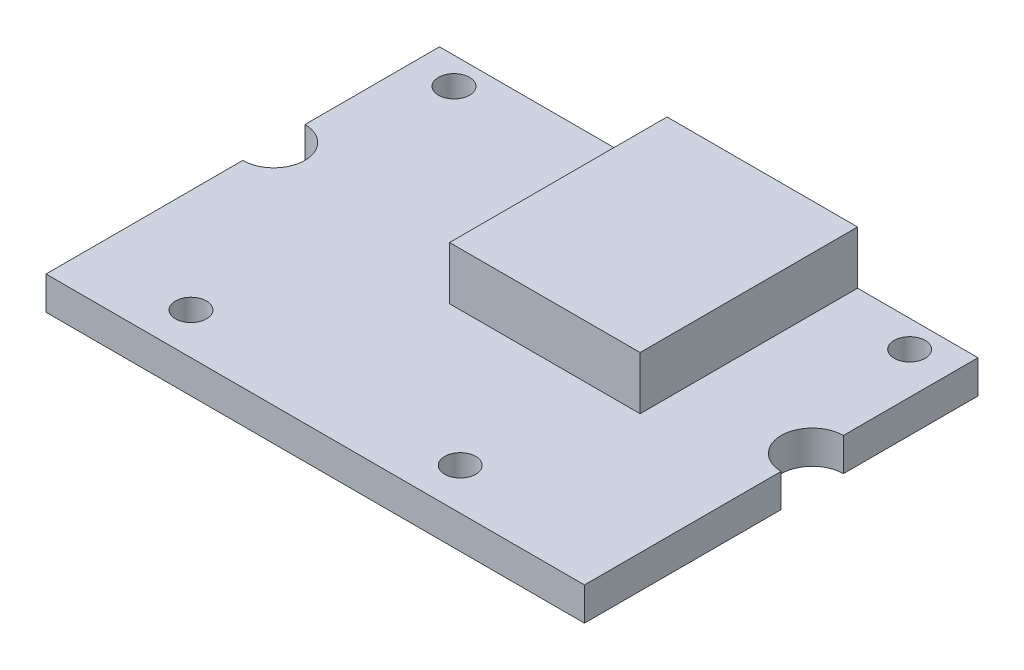
from build123d import *

# Parameters (mm, degrees)
SKETCH1_W           = 26
SKETCH1_H           = 19
BOSS_EXTRUDE1_DEPTH = 1.6
SKETCH2_W           = 9.2
SKETCH2_H           = 10.5
BOSS_EXTRUDE2_DEPTH = 2.56
SKETCH3_R           = 0.75
CUT_EXTRUDE1_DEPTH  = 17.30348429
SKETCH4_R           = 1.5
CUT_EXTRUDE2_DEPTH  = 17.30348429
SKETCH5_R           = 0.75
CUT_EXTRUDE3_DEPTH  = 17.30348429


with BuildPart() as part:
    # Sketch1 → Boss-Extrude1 (new body)
    with BuildSketch(Plane(origin=(0, 0, 0), x_dir=(1, 0, 0), z_dir=(0, 1, 0))):
        Rectangle(SKETCH1_W, SKETCH1_H)
    extrude(amount=BOSS_EXTRUDE1_DEPTH)

    # Sketch2 → Boss-Extrude2 (add)
    with BuildSketch(Plane(origin=(0, 1.6, 0), x_dir=(1, 0, 0), z_dir=(0, 1, 0))):
        with Locations((2.584875258, 4.25)):
            Rectangle(SKETCH2_W, SKETCH2_H)
    extrude(amount=BOSS_EXTRUDE2_DEPTH)

    # Sketch3 → Cut-Extrude1 (cut, through all)
    with BuildSketch(Plane(origin=(0, 1.6, 0), x_dir=(1, 0, 0), z_dir=(0, 1, 0))):
        with Locations((-8, -7.5)):
            Circle(SKETCH3_R)
        with Locations((5, -7.5)):
            Circle(SKETCH3_R)
    extrude(amount=-CUT_EXTRUDE1_DEPTH, mode=Mode.SUBTRACT)

    # Sketch4 → Cut-Extrude2 (cut, through all)
    with BuildSketch(Plane(origin=(0, 1.6, 0), x_dir=(1, 0, 0), z_dir=(0, 1, 0))):
        with Locations((-13, 1.5)):
            Circle(SKETCH4_R)
        with Locations((13, 1.5)):
            Circle(SKETCH4_R)
    extrude(amount=-CUT_EXTRUDE2_DEPTH, mode=Mode.SUBTRACT)

    # Sketch5 → Cut-Extrude3 (cut, through all)
    with BuildSketch(Plane(origin=(0, 1.6, 0), x_dir=(1, 0, 0), z_dir=(0, 1, 0))):
        with Locations((-11, 8.2)):
            Circle(SKETCH5_R)
        with Locations((11, 8.2)):
            Circle(SKETCH5_R)
    extrude(amount=-CUT_EXTRUDE3_DEPTH, mode=Mode.SUBTRACT)


solid = part.part
